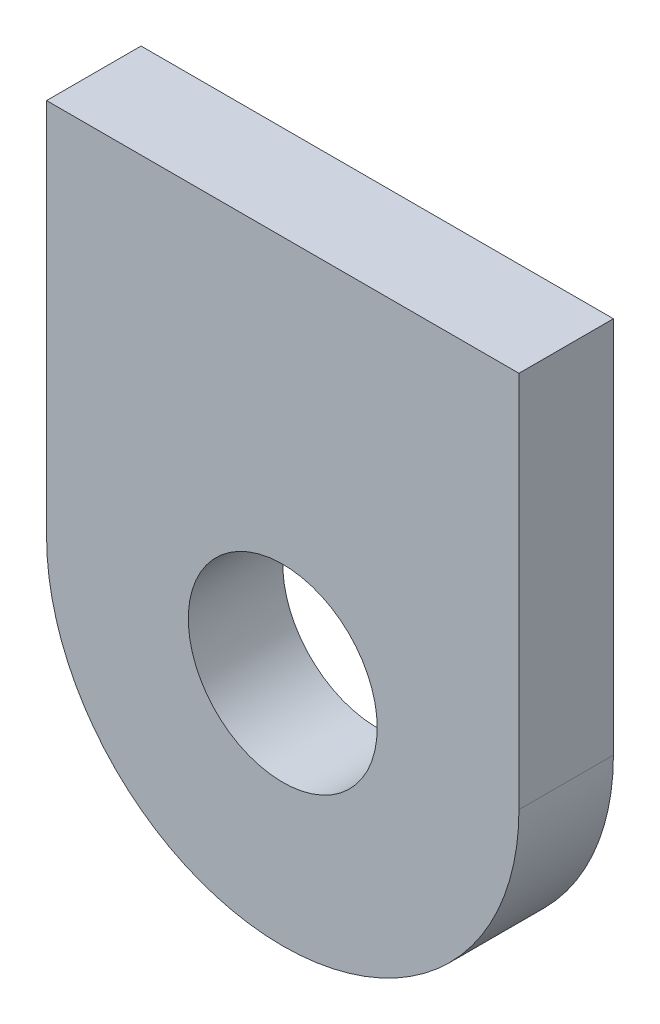
from build123d import *

# Parameters (mm, degrees)
SKETCH_1_R             = 30
SM_BASE_FLANGE_1_DEPTH = 30


# Sheet-metal steps are written as plain solids
with BuildPart() as part:
    # Sketch 1 → 基体-法兰1 (new body)
    with BuildSketch(Plane.XY):
        with BuildLine():
            Line((0, 0), (150, 0))
            Line((150, 0), (150, -120))
            ThreePointArc((150, -120), (75, -195), (0, -120))
            Line((0, -120), (0, 0))
        make_face()
        with Locations((75, -120)):
            Circle(SKETCH_1_R, mode=Mode.SUBTRACT)
    extrude(amount=-SM_BASE_FLANGE_1_DEPTH)


solid = part.part
